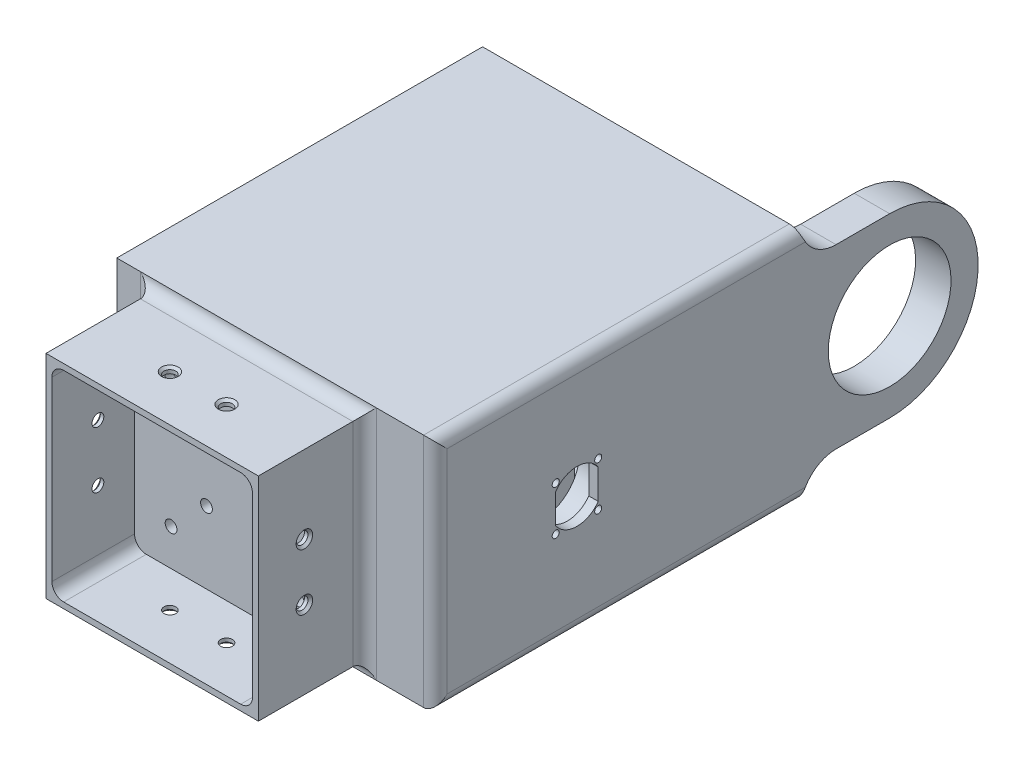
from build123d import *

# Parameters (mm, degrees)
SKETCH2_W               = 90
SKETCH2_H               = 90
BOSS_EXTRUDE1_DEPTH     = 45
SKETCH3_W               = 85
SKETCH3_H               = 85
CUT_EXTRUDE1_DEPTH      = 35
SKETCH4_R               = 2.5
CUT_EXTRUDE2_DEPTH      = 111.227038425
FILLET1_R               = 5
SKETCH5_R               = 2.5
CUT_EXTRUDE3_DEPTH      = 111.227038425
CHAMFER1_SIZE           = 1
SKETCH7_W               = 150
SKETCH7_H               = 100
BOSS_EXTRUDE2_DEPTH     = 155
SKETCH8_W               = 120
SKETCH8_H               = 70
CUT_EXTRUDE5_DEPTH      = 135
SKETCH9_R               = 2.5
CUT_EXTRUDE6_DEPTH      = 189.01595677
FILLET3_R               = 5
SKETCH12_W              = 15
SKETCH12_H              = 75
BOSS_EXTRUDE3_DEPTH     = 75
SKETCH13_R              = 26
CUT_EXTRUDE8_DEPTH      = 75
CUT_EXTRUDE9_DEPTH      = 280.105714739
CUT_EXTRUDE9_DEPTH_BACK = 75
FILLET6_R               = 15
FILLET7_R               = 5
CUT_EXTRUDE11_REACH     = 221.374
SKETCH15_W              = 15
SKETCH15_H              = 100
SKETCH16_R              = 2
CUT_EXTRUDE12_DEPTH     = 10
CUT_EXTRUDE13_REACH     = 266.197
SKETCH17_R              = 1.5
CUT_EXTRUDE15_REACH     = 266.197
SKETCH19_R              = 16
CUT_EXTRUDE16_DEPTH     = 11
SKETCH20_W              = 20
SKETCH20_H              = 48
BOSS_EXTRUDE4_DEPTH     = 35
CUT_EXTRUDE17_REACH     = 253.992
SKETCH22_R              = 1.5
CUT_EXTRUDE18_DEPTH     = 10
SKETCH25_R              = 1.5
CUT_EXTRUDE19_DEPTH     = 10
SKETCH26_W              = 15
SKETCH26_H              = 48
BOSS_EXTRUDE5_DEPTH     = 35
CUT_EXTRUDE20_REACH     = 250.596
SKETCH29_R              = 1.5
CUT_EXTRUDE21_DEPTH     = 10


# Some blends are built 0.0001 mm under size
with BuildPart() as part:
    # Sketch2 → Boss-Extrude1 (new body)
    with BuildSketch(Plane.XY):
        Rectangle(SKETCH2_W, SKETCH2_H)
    extrude(amount=BOSS_EXTRUDE1_DEPTH)

    # Sketch3 → Cut-Extrude1 (cut)
    with BuildSketch(Plane.XY.offset(45)):
        Rectangle(SKETCH3_W, SKETCH3_H)
    extrude(amount=-CUT_EXTRUDE1_DEPTH, mode=Mode.SUBTRACT)

    # Sketch4 → Cut-Extrude2 (cut, through all)
    with BuildSketch(Plane.ZY.offset(45)):
        with Locations(Location((25.5, 12, 0), (0, 0, 270))):
            Circle(SKETCH4_R)
        with Locations(Location((25.5, -12, 0), (0, 0, 270))):
            Circle(SKETCH4_R)
    extrude(amount=-CUT_EXTRUDE2_DEPTH, mode=Mode.SUBTRACT)

    # Fillet1
    fillet1_edges = [part.edges().sort_by_distance(p)[0] for p in [
        (42.5, 42.5, 27.5),
        (42.5, -42.5, 27.5),
        (-42.5, -42.5, 27.5),
        (-42.5, 42.5, 27.5),
    ]]
    fillet(fillet1_edges, radius=FILLET1_R)

    # Sketch5 → Cut-Extrude3 (cut, through all)
    with BuildSketch(Plane(origin=(0, 45, 0), x_dir=(1, 0, 0), z_dir=(0, 1, 0))):
        with Locations(Location((-12, -25.5, 0), (0, 0, 270))):
            Circle(SKETCH5_R)
        with Locations(Location((12, -25.5, 0), (0, 0, 270))):
            Circle(SKETCH5_R)
    extrude(amount=-CUT_EXTRUDE3_DEPTH, mode=Mode.SUBTRACT)

    # Chamfer1
    chamfer1_edges = [part.edges().sort_by_distance(p)[0] for p in [
        (45, 14.5, 25.5),
        (-45, 14.5, 25.5),
        (45, -9.5, 25.5),
        (-45, -9.5, 25.5),
        (-12, -45, 23),
        (-12, 45, 23),
        (12, -45, 23),
        (12, 45, 23),
    ]]
    chamfer(chamfer1_edges, length=CHAMFER1_SIZE)

    # Sketch7 → Boss-Extrude2 (add)
    with BuildSketch(Plane(origin=(0, 0, 0), x_dir=(-1, 0, 0), z_dir=(0, 0, -1))):
        Rectangle(SKETCH7_W, SKETCH7_H)
    extrude(amount=BOSS_EXTRUDE2_DEPTH)

    # Sketch8 → Cut-Extrude5 (cut)
    with BuildSketch(Plane(origin=(0, 0, -155), x_dir=(-1, 0, 0), z_dir=(0, 0, -1))):
        Rectangle(SKETCH8_W, SKETCH8_H)
    extrude(amount=-CUT_EXTRUDE5_DEPTH, mode=Mode.SUBTRACT)

    # Sketch9 → Cut-Extrude6 (cut, through all)
    with BuildSketch(Plane.XY.offset(10)):
        with Locations((-27, 27)):
            Circle(SKETCH9_R)
        with Locations((27, 27)):
            Circle(SKETCH9_R)
        with Locations((27, -27)):
            Circle(SKETCH9_R)
        with Locations((-27, -27)):
            Circle(SKETCH9_R)
        with Locations((-12, 12)):
            Circle(SKETCH9_R)
        with Locations((12, 12)):
            Circle(SKETCH9_R)
        with Locations((-12, -12)):
            Circle(SKETCH9_R)
        with Locations((12, -12)):
            Circle(SKETCH9_R)
    extrude(amount=-CUT_EXTRUDE6_DEPTH, mode=Mode.SUBTRACT)

    # Fillet3
    fillet3_edges = [part.edges().sort_by_distance(p)[0] for p in [
        (0, -45, 0),
        (-45, 0, 0),
        (0, 45, 0),
        (45, 0, 0),
    ]]
    fillet(fillet3_edges, radius=FILLET3_R - 0.0001)  # a hair under: the kernel refuses the full size

    # Sketch12 → Boss-Extrude3 (add)
    with BuildSketch(Plane(origin=(0, 0, -155), x_dir=(-1, 0, 0), z_dir=(0, 0, -1))):
        with Locations((-67.5, 0)):
            Rectangle(SKETCH12_W, SKETCH12_H)
    extrude(amount=BOSS_EXTRUDE3_DEPTH)

    # Sketch13 → Cut-Extrude8 (cut)
    with BuildSketch(Plane.ZY.offset(-60)):
        with Locations(Location((-192.5, 0, 0), (0, 0, 270))):
            Circle(SKETCH13_R)
    extrude(amount=-CUT_EXTRUDE8_DEPTH, mode=Mode.SUBTRACT)

    # Sketch14 → Cut-Extrude9 (cut, two sides: drawn at the far end of the back side and taken through both)
    with BuildSketch(Plane(origin=(75, 0, 0), x_dir=(0, 0, -1), z_dir=(1, 0, 0)).offset(-CUT_EXTRUDE9_DEPTH_BACK)):
        with BuildLine():
            Line((230, 37.5), (192.500003688, 37.5))
            ThreePointArc((192.500003688, 37.5), (219.016505566, 26.516503023), (230, 9.1e-08))
            Line((230, 9.1e-08), (230, 37.5))
        make_face()
        with BuildLine():
            Line((230, -37.5), (230, 9.1e-08))
            ThreePointArc((230, 9.1e-08), (219.016505635, -26.516502954), (192.500003701, -37.5))
            Line((192.500003701, -37.5), (230, -37.5))
        make_face()
    extrude(amount=CUT_EXTRUDE9_DEPTH + CUT_EXTRUDE9_DEPTH_BACK, mode=Mode.SUBTRACT)

    # Fillet6
    # the kernel refuses this fillet: 15 mm, written as the material it adds along each edge
    with BuildSketch(Plane(origin=(60, -37.5, -155), x_dir=(0, -1, 0), z_dir=(1, 0, 0)), Plane(origin=(75, 37.5, -155), x_dir=(0, 1, 0), z_dir=(-1, 0, 0))) as fillet6_piece_1:
        with BuildLine():
            CenterArc((15, 14.790199458), FILLET6_R, 180, 80.405931773)
            Line((0, 14.790199458), (-0.3, 14.790199458))
            Line((-0.3, 14.790199458), (-0.3, 0))
            Line((-0.3, 0), (0, -0.3))
            ThreePointArc((0, -0.3), (6.25, -0.3), (12.45, -0.295803989))
            Line((12.45, -0.295803989), (12.5, 0))
        make_face()
    extrude(amount=15)

    # Fillet7
    fillet7_edges = [part.edges().sort_by_distance(p)[0] for p in [
        (75, 0, 0),
        (75, 50, -77.5),
        (75, -50, -77.5),
    ]]
    fillet(fillet7_edges, radius=FILLET7_R)

    # Sketch15 → Cut-Extrude11 (cut, up to next)
    with BuildSketch(Plane(origin=(0, 0, -155), x_dir=(-1, 0, 0), z_dir=(0, 0, -1)), mode=Mode.PRIVATE) as cut_extrude11_sk1:
        with Locations((67.5, 0)):
            Rectangle(SKETCH15_W, SKETCH15_H)
    cut_extrude11_tool1 = extrude(cut_extrude11_sk1.sketch, amount=-CUT_EXTRUDE11_REACH, mode=Mode.PRIVATE) & part.part
    add(cut_extrude11_tool1.solids().sort_by_distance((-67.5, 0, -155))[0], mode=Mode.SUBTRACT)

    # Sketch16 → Cut-Extrude12 (cut)
    with BuildSketch(Plane.ZY.offset(60)):
        with Locations((-7.5, -42.5)):
            Circle(SKETCH16_R)
        with Locations((-42.5, -42.5)):
            Circle(SKETCH16_R)
        with Locations((-77.5, -42.5)):
            Circle(SKETCH16_R)
        with Locations((-112.5, -42.5)):
            Circle(SKETCH16_R)
        with Locations((-147.5, -42.5)):
            Circle(SKETCH16_R)
        with Locations(Location((-147.5, 42.5, 0), (0, 0, 180))):
            Circle(SKETCH16_R)
        with Locations(Location((-112.5, 42.5, 0), (0, 0, 180))):
            Circle(SKETCH16_R)
        with Locations(Location((-77.5, 42.5, 0), (0, 0, 180))):
            Circle(SKETCH16_R)
        with Locations(Location((-42.5, 42.5, 0), (0, 0, 180))):
            Circle(SKETCH16_R)
        with Locations(Location((-7.5, 42.5, 0), (0, 0, 180))):
            Circle(SKETCH16_R)
        with Locations(Location((-7.5, 12.5, 0), (0, 0, 180))):
            Circle(SKETCH16_R)
        with Locations(Location((-7.5, -17.5, 0), (0, 0, 180))):
            Circle(SKETCH16_R)
    extrude(amount=-CUT_EXTRUDE12_DEPTH, mode=Mode.SUBTRACT)

    # Sketch17 → Cut-Extrude13 (cut, up to next)
    with BuildSketch(Plane.ZY.offset(-60), mode=Mode.PRIVATE) as cut_extrude13_sk1:
        with Locations(Location((-69, 9.38083152, 0), (0, 0, 270))):
            Circle(SKETCH17_R)
    cut_extrude13_tool1 = extrude(cut_extrude13_sk1.sketch, amount=-CUT_EXTRUDE13_REACH, mode=Mode.PRIVATE) & part.part
    # Sketch17 → Cut-Extrude13 (cut, up to next)
    with BuildSketch(Plane.ZY.offset(-60), mode=Mode.PRIVATE) as cut_extrude13_sk2:
        with Locations(Location((-51, 9.38083152, 0), (0, 0, 270))):
            Circle(SKETCH17_R)
    cut_extrude13_tool2 = extrude(cut_extrude13_sk2.sketch, amount=-CUT_EXTRUDE13_REACH, mode=Mode.PRIVATE) & part.part
    # Sketch17 → Cut-Extrude13 (cut, up to next)
    with BuildSketch(Plane.ZY.offset(-60), mode=Mode.PRIVATE) as cut_extrude13_sk3:
        with Locations(Location((-51, -9.38083152, 0), (0, 0, 270))):
            Circle(SKETCH17_R)
    cut_extrude13_tool3 = extrude(cut_extrude13_sk3.sketch, amount=-CUT_EXTRUDE13_REACH, mode=Mode.PRIVATE) & part.part
    # Sketch17 → Cut-Extrude13 (cut, up to next)
    with BuildSketch(Plane.ZY.offset(-60), mode=Mode.PRIVATE) as cut_extrude13_sk4:
        with Locations(Location((-69, -9.38083152, 0), (0, 0, 270))):
            Circle(SKETCH17_R)
    cut_extrude13_tool4 = extrude(cut_extrude13_sk4.sketch, amount=-CUT_EXTRUDE13_REACH, mode=Mode.PRIVATE) & part.part
    add(cut_extrude13_tool1.solids().sort_by_distance((60, 9.380832, -69))[0], mode=Mode.SUBTRACT)
    add(cut_extrude13_tool2.solids().sort_by_distance((60, 9.380832, -51))[0], mode=Mode.SUBTRACT)
    add(cut_extrude13_tool3.solids().sort_by_distance((60, -9.380832, -51))[0], mode=Mode.SUBTRACT)
    add(cut_extrude13_tool4.solids().sort_by_distance((60, -9.380832, -69))[0], mode=Mode.SUBTRACT)

    # Sketch18 → Cut-Extrude15 (cut, up to next)
    with BuildSketch(Plane.ZY.offset(-60), mode=Mode.PRIVATE) as cut_extrude15_sk1:
        with BuildLine():
            Line((-69, 6.32455532), (-69, -6.32455532))
            ThreePointArc((-69, -6.32455532), (-60, -11), (-51, -6.32455532))
            Line((-51, -6.32455532), (-51, 6.32455532))
            ThreePointArc((-51, 6.32455532), (-60, 11), (-69, 6.32455532))
        make_face()
    cut_extrude15_tool1 = extrude(cut_extrude15_sk1.sketch, amount=-CUT_EXTRUDE15_REACH, mode=Mode.PRIVATE) & part.part
    add(cut_extrude15_tool1.solids().sort_by_distance((60, 0, -60))[0], mode=Mode.SUBTRACT)

    # Sketch19 → Cut-Extrude16 (cut)
    with BuildSketch(Plane.ZY.offset(-60)):
        with Locations(Location((-60, 0, 0), (0, 0, 270))):
            Circle(SKETCH19_R)
    extrude(amount=-CUT_EXTRUDE16_DEPTH, mode=Mode.SUBTRACT)

    # Sketch20 → Boss-Extrude4 (add)
    with BuildSketch(Plane(origin=(0, -35, 0), x_dir=(1, 0, 0), z_dir=(0, 1, 0))):
        with Locations((40, 60)):
            Rectangle(SKETCH20_W, SKETCH20_H)
    extrude(amount=BOSS_EXTRUDE4_DEPTH)

    # Sketch21 → Cut-Extrude17 (cut, up to next)
    with BuildSketch(Plane.ZY.offset(-30), mode=Mode.PRIVATE) as cut_extrude17_sk1:
        with BuildLine():
            Line((-76, 0), (-44, 0))
            ThreePointArc((-44, 0), (-60, -16), (-76, 0))
        make_face()
    cut_extrude17_tool1 = extrude(cut_extrude17_sk1.sketch, amount=-CUT_EXTRUDE17_REACH, mode=Mode.PRIVATE) & part.part
    add(cut_extrude17_tool1.solids().sort_by_distance((30, -6.790611, -60))[0], mode=Mode.SUBTRACT)

    # Sketch22 → Cut-Extrude18 (cut)
    with BuildSketch(Plane(origin=(0, 0, 0), x_dir=(1, 0, 0), z_dir=(0, 1, 0))):
        with Locations(Location((40, 80, 0), (0, 0, 270))):
            Circle(SKETCH22_R)
    extrude(amount=-CUT_EXTRUDE18_DEPTH, mode=Mode.SUBTRACT)

    # Sketch25 → Cut-Extrude19 (cut)
    with BuildSketch(Plane(origin=(0, 0, 0), x_dir=(1, 0, 0), z_dir=(0, 1, 0))):
        with Locations(Location((40, 40, 0), (0, 0, 270))):
            Circle(SKETCH25_R)
    extrude(amount=-CUT_EXTRUDE19_DEPTH, mode=Mode.SUBTRACT)

    # Sketch26 → Boss-Extrude5 (add)
    with BuildSketch(Plane(origin=(0, -35, 0), x_dir=(1, 0, 0), z_dir=(0, 1, 0))):
        with Locations((2.5, 60)):
            Rectangle(SKETCH26_W, SKETCH26_H)
    extrude(amount=BOSS_EXTRUDE5_DEPTH)

    # Sketch27 → Cut-Extrude20 (cut, up to next)
    with BuildSketch(Plane.ZY.offset(5), mode=Mode.PRIVATE) as cut_extrude20_sk1:
        with BuildLine():
            Line((-73.8, 0), (-46.2, 0))
            ThreePointArc((-46.2, 0), (-60, -13.8), (-73.8, 0))
        make_face()
    cut_extrude20_tool1 = extrude(cut_extrude20_sk1.sketch, amount=-CUT_EXTRUDE20_REACH, mode=Mode.PRIVATE) & part.part
    add(cut_extrude20_tool1.solids().sort_by_distance((-5, -5.856902, -60))[0], mode=Mode.SUBTRACT)

    # Sketch29 → Cut-Extrude21 (cut)
    with BuildSketch(Plane(origin=(0, 0, 0), x_dir=(1, 0, 0), z_dir=(0, 1, 0))):
        with Locations(Location((2.5, 78.9, 0), (0, 0, 270))):
            Circle(SKETCH29_R)
    cut_extrude21 = extrude(amount=-CUT_EXTRUDE21_DEPTH, mode=Mode.SUBTRACT)

    # Mirror3: Cut-Extrude21 across plane
    add(cut_extrude21.mirror(Plane(origin=(0, 0, -60), x_dir=(1, 0, 0), z_dir=(0, 0, -1))), mode=Mode.SUBTRACT)


solid = part.part
